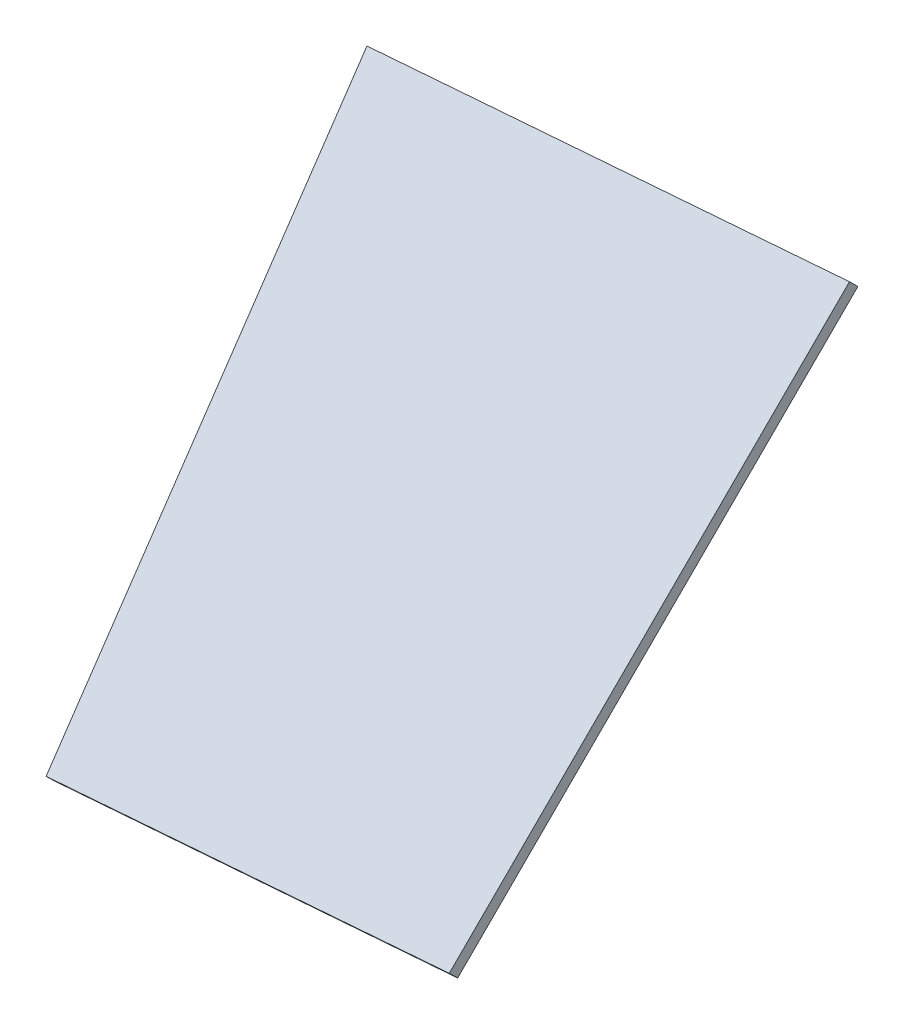
from build123d import *

# Parameters (mm, degrees)
BOSS_EXTRUDE1_DEPTH = 12.7


with BuildPart() as part:
    # PedalBox Floor → Boss-Extrude1 (new body)
    with BuildSketch(Plane(origin=(97.638093026, 1052.882301884, 1069.282220177), x_dir=(-0.9974726527085804, 0.06614150983086205, 0.025953954916387485), z_dir=(-0.06492694194116505, -0.7001409589903271, -0.71104650322906))):
        Polygon((879.711859592, -469.716796092), (867.323665837, -1020.605655669), (1228.87646508, -1052.271271538), (1312.438517927, -507.615980299), align=None)
    extrude(amount=BOSS_EXTRUDE1_DEPTH)


solid = part.part
